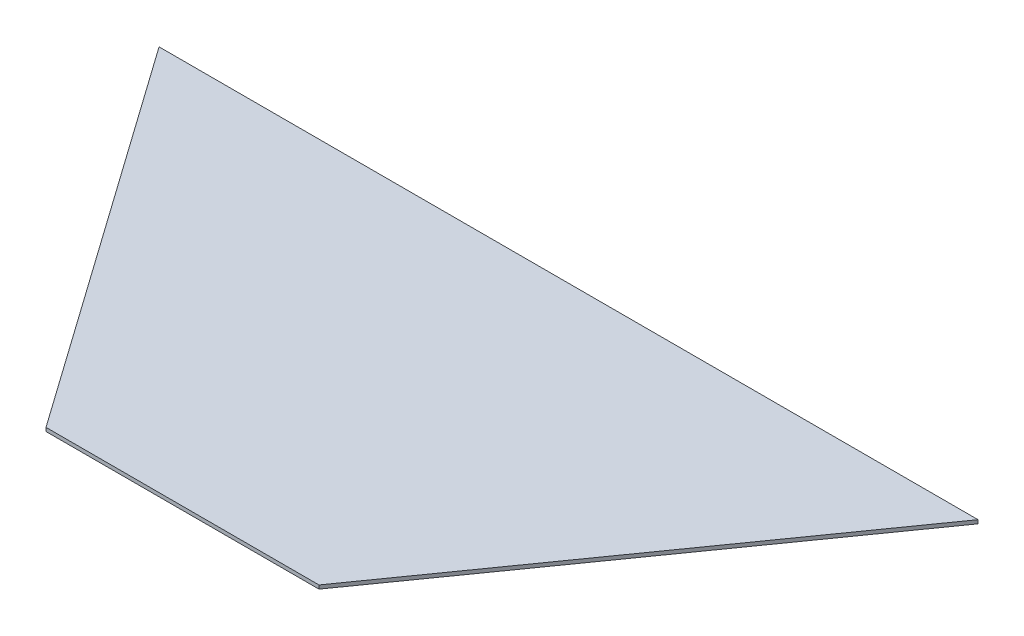
from build123d import *

# Parameters (mm, degrees)
BOSS_EXTRUDE1_DEPTH = 1.5


with BuildPart() as part:
    # Sketch1 → Boss-Extrude1 (new body)
    with BuildSketch(Plane(origin=(0, 0, 0), x_dir=(1, 0, 0), z_dir=(0, 1, 0))):
        Polygon((-168.110535, 158.496132383), (-56.036845, 0), (56.036845, 0), (168.110535, 158.496132383), align=None)
    extrude(amount=BOSS_EXTRUDE1_DEPTH)


solid = part.part
